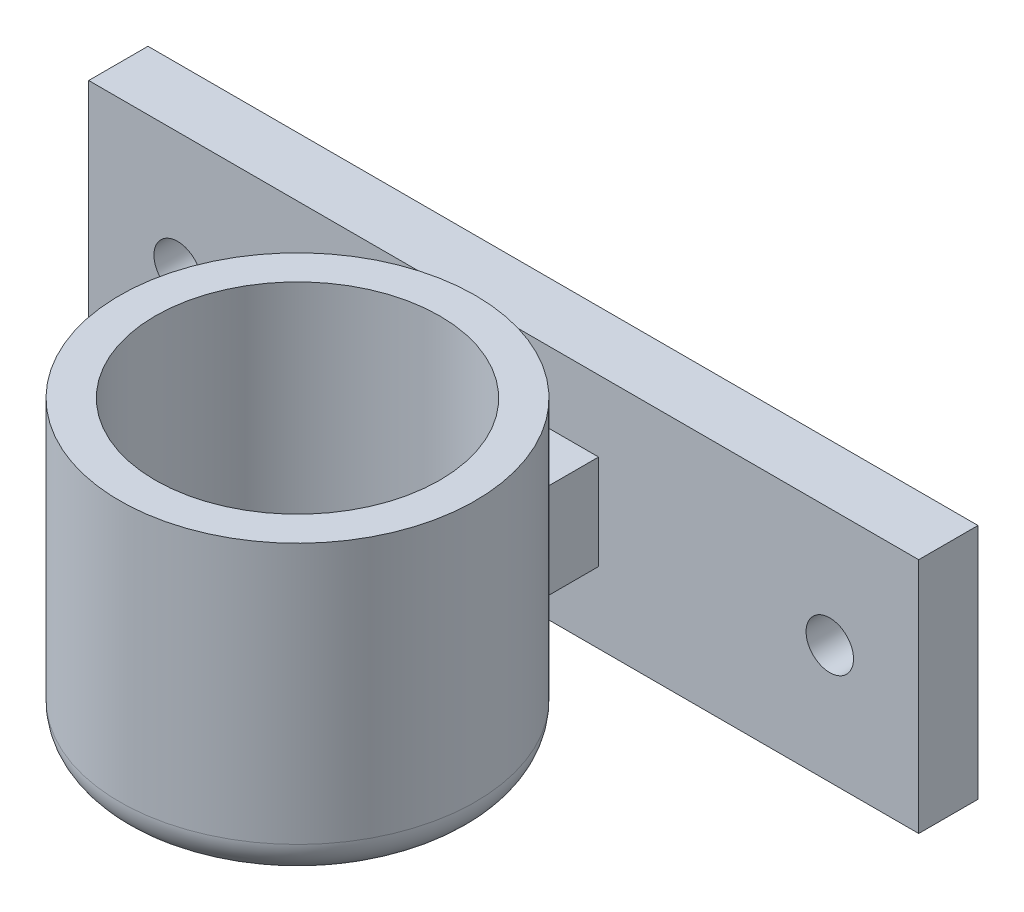
from build123d import *

# Parameters (mm, degrees)
SKETCH1_W                = 70
SKETCH1_H                = 20
SKETCH1_R                = 2
BOSS_EXTRUDE1_DEPTH      = 2.5
BOSS_EXTRUDE2_DEPTH      = 5
BOSS_EXTRUDE3_DEPTH      = 5
BOSS_EXTRUDE3_DEPTH_BACK = 17
SKETCH6_R                = 15
SKETCH6_R_2              = 12
SKETCH10_R               = 15
BOSS_EXTRUDE4_DEPTH      = 3
SKETCH11_R               = 2.5
CUT_EXTRUDE1_DEPTH       = 3
FILLET1_R                = 3


with BuildPart() as part:
    # Sketch1 → Boss-Extrude1 (new, symmetric)
    with BuildSketch(Plane.XY):
        with Locations((5.655737705, 20.655737705)):
            Rectangle(SKETCH1_W, SKETCH1_H)
        with Locations((-21.844262295, 20.655737705)):
            Circle(SKETCH1_R, mode=Mode.SUBTRACT)
        with Locations((33.155737705, 20.655737705)):
            Circle(SKETCH1_R, mode=Mode.SUBTRACT)
    extrude(amount=BOSS_EXTRUDE1_DEPTH, both=True)

    # Sketch4 → Boss-Extrude2 (add)
    with BuildSketch(Plane.XY.offset(2.5)):
        Polygon((5.655737705, 24.655737705), (13.655737705, 24.655737705), (13.655737705, 16.655737705), (5.655737705, 16.655737705), (-2.344262295, 16.655737705), (-2.344262295, 24.655737705), align=None)
    extrude(amount=BOSS_EXTRUDE2_DEPTH)

    # Sketch6 → Boss-Extrude3 (add, two sides: drawn at the far end of the back side and taken through both)
    with BuildSketch(Plane(origin=(0, 16.655737705, 0), x_dir=(-1, 0, 0), z_dir=(0, -1, 0)).offset(-BOSS_EXTRUDE3_DEPTH_BACK)):
        with Locations(Location((-5.655737705, -19.888643818, 0), (0, 0, 90))):
            Circle(SKETCH6_R)
        with Locations(Location((-5.655737705, -19.888643818, 0), (0, 0, 90))):
            Circle(SKETCH6_R_2, mode=Mode.SUBTRACT)
    extrude(amount=BOSS_EXTRUDE3_DEPTH + BOSS_EXTRUDE3_DEPTH_BACK)

    # Sketch10 → Boss-Extrude4 (add)
    with BuildSketch(Plane.XZ.offset(-11.655737705)):
        with Locations(Location((5.655737705, 19.888643818, 0), (0, 0, 270))):
            Circle(SKETCH10_R)
    extrude(amount=BOSS_EXTRUDE4_DEPTH)

    # Sketch11 → Cut-Extrude1 (cut)
    with BuildSketch(Plane.XZ.offset(-8.655737705)):
        with Locations(Location((5.655737705, 19.888643818, 0), (0, 0, 270))):
            Circle(SKETCH11_R)
    extrude(amount=-CUT_EXTRUDE1_DEPTH, mode=Mode.SUBTRACT)

    # Fillet1
    fillet1_edges = [part.edges().sort_by_distance(p)[0] for p in [
        (5.655737705, 8.655737705, 34.888643818),
    ]]
    fillet(fillet1_edges, radius=FILLET1_R - 0.0001)  # a hair under: the kernel refuses the full size


solid = part.part
